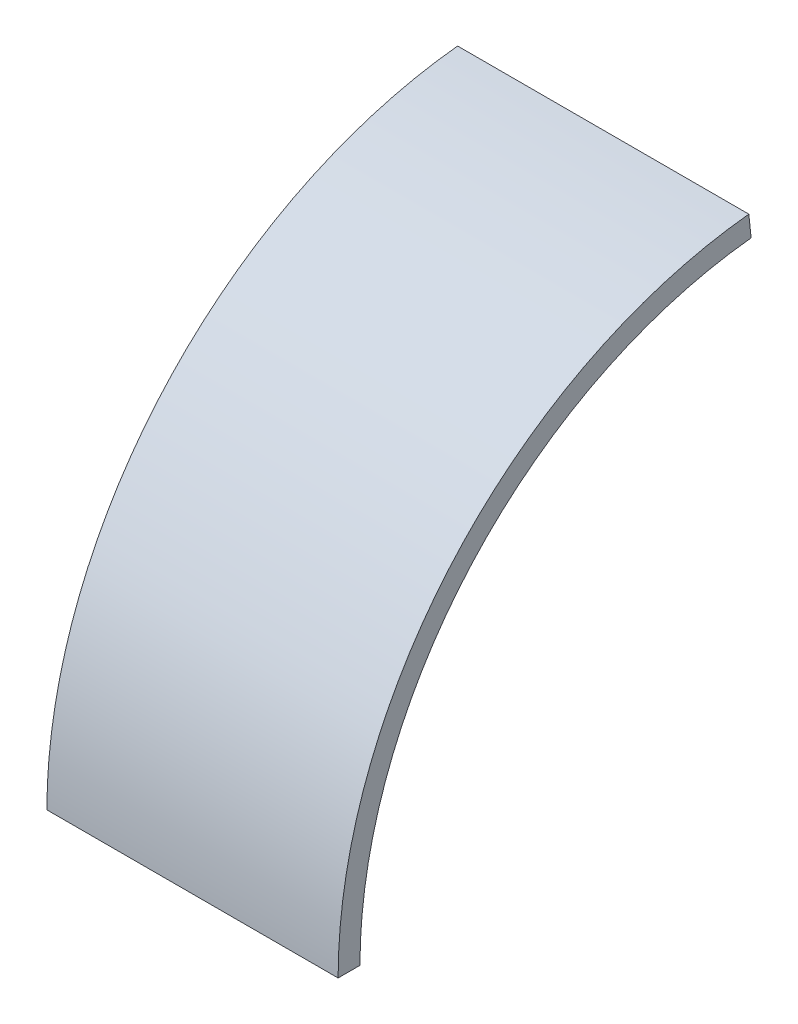
from build123d import *

# Parameters (mm, degrees)
SM_BASE_FLANGE_1_DEPTH = 10


# Sheet-metal steps are written as plain solids
with BuildPart() as part:
    # Sketch 1 → Базовая кромка1 (new, symmetric)
    with BuildSketch(Plane(origin=(0, 0, 0), x_dir=(0, 0, -1), z_dir=(1, 0, 0))):
        with BuildLine():
            ThreePointArc((-3.292646593, 31.327439704), (-23.409062003, 21.0776141), (-31.5, 0))
            Line((-31.5, 0), (-30, 0))
            ThreePointArc((-30, 0), (-22.294344764, 20.073918191), (-3.135853898, 29.835656861))
            Line((-3.135853898, 29.835656861), (-3.292646593, 31.327439704))
        make_face()
    extrude(amount=SM_BASE_FLANGE_1_DEPTH, both=True)


solid = part.part
